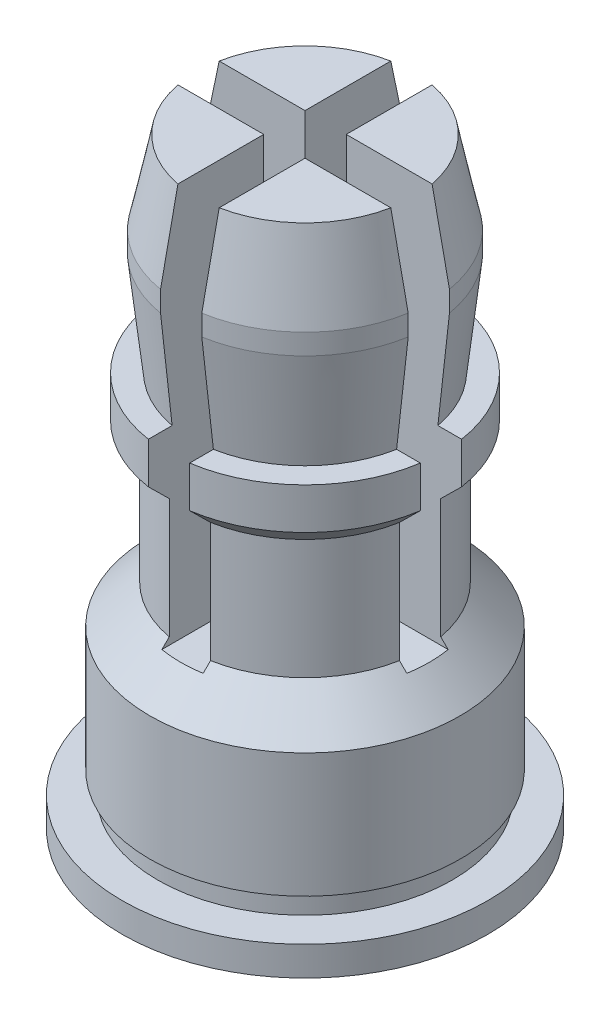
from build123d import *

# Parameters (mm, degrees)
SLITCUTSKE_W     = 5.336948004
SLITCUTSKE_H     = 0.71628
SLITCUT_DEPTH    = 6.860032
SLITCUTPAT_COUNT = 2
SLITCUTPAT_ANGLE = 90


with BuildPart() as part:
    # BodySke → Body (revolve)
    with BuildSketch(Plane.XY):
        Polygon((2.55778, 0.508), (2.55778, 0.889), (2.6924, 0.889), (2.6924, 3.043428), (2.02946, 3.706368), (2.02946, 5.78358), (2.3876, 6.14172), (2.3876, 6.858), (1.9812, 6.858), (2.17932, 8.6487), (2.17932, 9.00684), (1.88214, 10.4394), (0, 10.4394), (0, 0), (3.175, 0), (3.175, 0.508), align=None)
    revolve(axis=Axis((0, 0, 0), (0, 1, 0)))

    # SlitCutSke → SlitCut (cut)
    with BuildSketch(Plane(origin=(0, 10.4394, 0), x_dir=(-1, 0, 0), z_dir=(0, 1, 0))):
        Rectangle(SLITCUTSKE_W, SLITCUTSKE_H)
    slitcut = extrude(amount=-SLITCUT_DEPTH, mode=Mode.SUBTRACT)

    # SlitCutPat: SlitCut ×2 about axis
    slitcutpat_axis = Axis((0, 0, 0), (0, 1, 0))
    for i in range(1, SLITCUTPAT_COUNT):
        add(slitcut.rotate(slitcutpat_axis, i * SLITCUTPAT_ANGLE / (SLITCUTPAT_COUNT - 1)), mode=Mode.SUBTRACT)


solid = part.part
